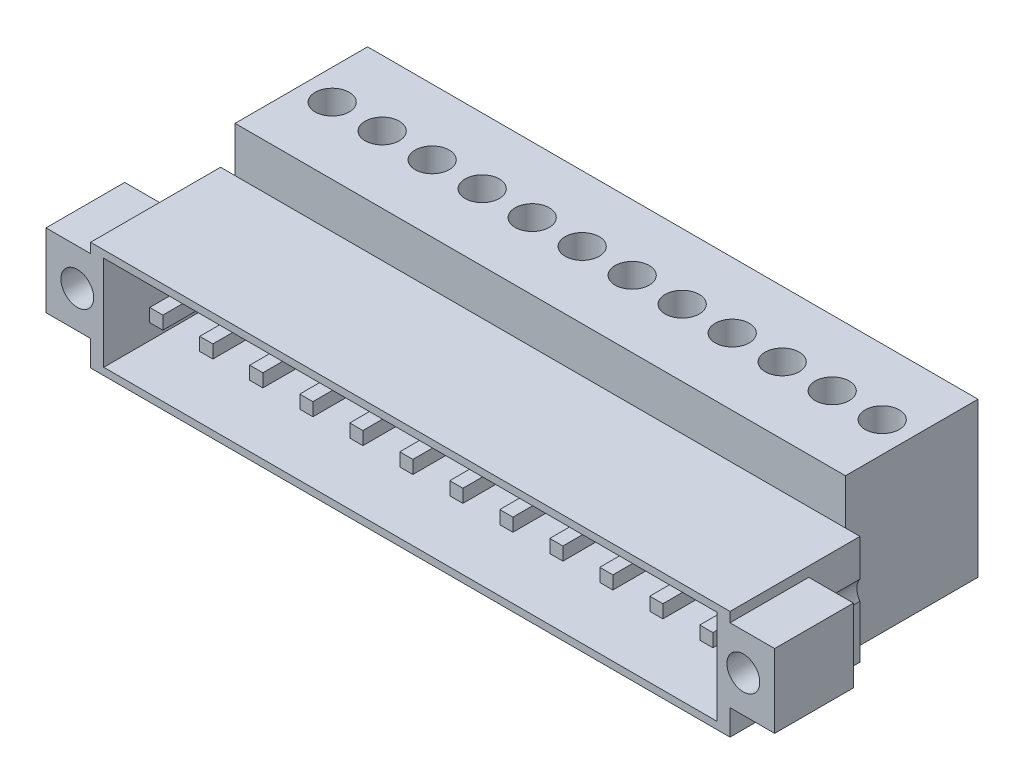
from build123d import *

# Parameters (mm, degrees)
SK_SHROUD_W             = 48.72
SK_SHROUD_H             = 8.3
SHROUD_DEPTH            = 9.9
SK_FLANGE_EARS_W        = 3.4
SK_FLANGE_EARS_H        = 5.6
FLANGE_EARS_DEPTH       = 6
SK_CAVITY_W             = 46.72
SK_CAVITY_H             = 7.2
CAVITY_DEPTH            = 7.6
SK_TERMINAL_BLOCK_W     = 46.51
SK_TERMINAL_BLOCK_H     = 11.75
TERMINAL_BLOCK_DEPTH    = 10.1
INSERT_HOLES_DEPTH      = 34.295909659
INSERT_HOLES_DEPTH_BACK = 34.295909659
SK_INSERT_HOLES_R       = 1.25
SK_CONTACT_PINS_W       = 1
SK_CONTACT_PINS_H       = 1
CONTACT_PINS_DEPTH      = 6
SK_WIRE_ENTRIES_W       = 2.6
SK_WIRE_ENTRIES_H       = 2.8
WIRE_ENTRIES_DEPTH      = 6
SK_CLAMP_SCREW_HOLES_R  = 1.3
CLAMP_SCREW_HOLES_DEPTH = 3


with BuildPart() as part:
    # SK Shroud → Shroud (new body)
    with BuildSketch(Plane.XY.offset(3)):
        with Locations((0, -0.6)):
            Rectangle(SK_SHROUD_W, SK_SHROUD_H)
    extrude(amount=-SHROUD_DEPTH)

    # SK Flange ears → Flange ears (add)
    with BuildSketch(Plane.XY.offset(3)):
        with Locations((26.06, 0)):
            Rectangle(SK_FLANGE_EARS_W, SK_FLANGE_EARS_H)
        with Locations((-26.06, 0)):
            Rectangle(SK_FLANGE_EARS_W, SK_FLANGE_EARS_H)
    extrude(amount=-FLANGE_EARS_DEPTH)

    # SK Cavity → Cavity (cut)
    with BuildSketch(Plane.XY.offset(3)):
        with Locations((0, -0.6)):
            Rectangle(SK_CAVITY_W, SK_CAVITY_H)
    extrude(amount=-CAVITY_DEPTH, mode=Mode.SUBTRACT)

    # SK Terminal block → Terminal block (add)
    with BuildSketch(Plane.XY.offset(-6.9)):
        with Locations((0, 1.125)):
            Rectangle(SK_TERMINAL_BLOCK_W, SK_TERMINAL_BLOCK_H)
    extrude(amount=-TERMINAL_BLOCK_DEPTH)

    # SK Insert holes → Insert holes (cut, two sides: drawn at the far end of the back side and taken through both)
    with BuildSketch(Plane.XY.offset(-INSERT_HOLES_DEPTH_BACK)):
        with Locations((-25.375, 0)):
            Circle(SK_INSERT_HOLES_R)
        with Locations((25.375, 0)):
            Circle(SK_INSERT_HOLES_R)
    extrude(amount=INSERT_HOLES_DEPTH + INSERT_HOLES_DEPTH_BACK, mode=Mode.SUBTRACT)

    # SK Contact pins → Contact pins (add)
    with BuildSketch(Plane.XY.offset(-4.6)):
        with Locations((-20.955, -0.6)):
            Rectangle(SK_CONTACT_PINS_W, SK_CONTACT_PINS_H)
        with Locations((-17.145, -0.6)):
            Rectangle(SK_CONTACT_PINS_W, SK_CONTACT_PINS_H)
        with Locations((-13.335, -0.6)):
            Rectangle(SK_CONTACT_PINS_W, SK_CONTACT_PINS_H)
        with Locations((-9.525, -0.6)):
            Rectangle(SK_CONTACT_PINS_W, SK_CONTACT_PINS_H)
        with Locations((-5.715, -0.6)):
            Rectangle(SK_CONTACT_PINS_W, SK_CONTACT_PINS_H)
        with Locations((-1.905, -0.6)):
            Rectangle(SK_CONTACT_PINS_W, SK_CONTACT_PINS_H)
        with Locations((1.905, -0.6)):
            Rectangle(SK_CONTACT_PINS_W, SK_CONTACT_PINS_H)
        with Locations((5.715, -0.6)):
            Rectangle(SK_CONTACT_PINS_W, SK_CONTACT_PINS_H)
        with Locations((9.525, -0.6)):
            Rectangle(SK_CONTACT_PINS_W, SK_CONTACT_PINS_H)
        with Locations((13.335, -0.6)):
            Rectangle(SK_CONTACT_PINS_W, SK_CONTACT_PINS_H)
        with Locations((17.145, -0.6)):
            Rectangle(SK_CONTACT_PINS_W, SK_CONTACT_PINS_H)
        with Locations((20.955, -0.6)):
            Rectangle(SK_CONTACT_PINS_W, SK_CONTACT_PINS_H)
    extrude(amount=CONTACT_PINS_DEPTH)

    # SK Wire entries → Wire entries (cut)
    with BuildSketch(Plane.XY.offset(-17)):
        with Locations((-20.955, -2)):
            Rectangle(SK_WIRE_ENTRIES_W, SK_WIRE_ENTRIES_H)
        with Locations((-17.145, -2)):
            Rectangle(SK_WIRE_ENTRIES_W, SK_WIRE_ENTRIES_H)
        with Locations((-13.335, -2)):
            Rectangle(SK_WIRE_ENTRIES_W, SK_WIRE_ENTRIES_H)
        with Locations((-9.525, -2)):
            Rectangle(SK_WIRE_ENTRIES_W, SK_WIRE_ENTRIES_H)
        with Locations((-5.715, -2)):
            Rectangle(SK_WIRE_ENTRIES_W, SK_WIRE_ENTRIES_H)
        with Locations((-1.905, -2)):
            Rectangle(SK_WIRE_ENTRIES_W, SK_WIRE_ENTRIES_H)
        with Locations((1.905, -2)):
            Rectangle(SK_WIRE_ENTRIES_W, SK_WIRE_ENTRIES_H)
        with Locations((5.715, -2)):
            Rectangle(SK_WIRE_ENTRIES_W, SK_WIRE_ENTRIES_H)
        with Locations((9.525, -2)):
            Rectangle(SK_WIRE_ENTRIES_W, SK_WIRE_ENTRIES_H)
        with Locations((13.335, -2)):
            Rectangle(SK_WIRE_ENTRIES_W, SK_WIRE_ENTRIES_H)
        with Locations((17.145, -2)):
            Rectangle(SK_WIRE_ENTRIES_W, SK_WIRE_ENTRIES_H)
        with Locations((20.955, -2)):
            Rectangle(SK_WIRE_ENTRIES_W, SK_WIRE_ENTRIES_H)
    extrude(amount=WIRE_ENTRIES_DEPTH, mode=Mode.SUBTRACT)

    # SK Clamp screw holes → Clamp screw holes (cut)
    with BuildSketch(Plane(origin=(0, 7, 0), x_dir=(1, 0, 0), z_dir=(0, 1, 0))):
        with Locations((-20.955, 12)):
            Circle(SK_CLAMP_SCREW_HOLES_R)
        with Locations((-17.145, 12)):
            Circle(SK_CLAMP_SCREW_HOLES_R)
        with Locations((-13.335, 12)):
            Circle(SK_CLAMP_SCREW_HOLES_R)
        with Locations((-9.525, 12)):
            Circle(SK_CLAMP_SCREW_HOLES_R)
        with Locations((-5.715, 12)):
            Circle(SK_CLAMP_SCREW_HOLES_R)
        with Locations((-1.905, 12)):
            Circle(SK_CLAMP_SCREW_HOLES_R)
        with Locations((1.905, 12)):
            Circle(SK_CLAMP_SCREW_HOLES_R)
        with Locations((5.715, 12)):
            Circle(SK_CLAMP_SCREW_HOLES_R)
        with Locations((9.525, 12)):
            Circle(SK_CLAMP_SCREW_HOLES_R)
        with Locations((13.335, 12)):
            Circle(SK_CLAMP_SCREW_HOLES_R)
        with Locations((17.145, 12)):
            Circle(SK_CLAMP_SCREW_HOLES_R)
        with Locations((20.955, 12)):
            Circle(SK_CLAMP_SCREW_HOLES_R)
    extrude(amount=-CLAMP_SCREW_HOLES_DEPTH, mode=Mode.SUBTRACT)


solid = part.part
